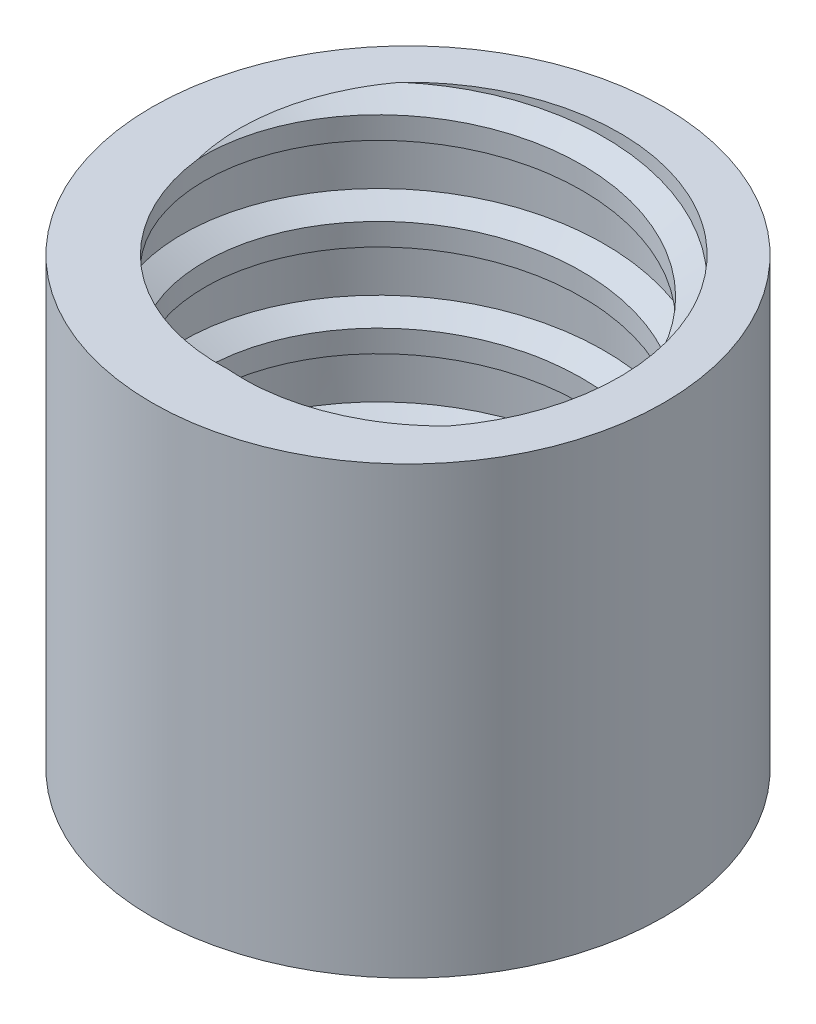
from build123d import *

# Parameters (mm, degrees)
SKETCH1_R           = 11.5
SKETCH1_R_2         = 8.5
BOSS_EXTRUDE1_DEPTH = 20
CUT_SWEEP1_PITCH    = 4.15


with BuildPart() as part:
    # Sketch1 → Boss-Extrude1 (new body)
    with BuildSketch(Plane(origin=(0, 0, 0), x_dir=(1, 0, 0), z_dir=(0, 1, 0))):
        with Locations(Location((0, 0, 0), (0, 0, 270))):
            Circle(SKETCH1_R)
        with Locations(Location((0, 0, 0), (0, 0, 270))):
            Circle(SKETCH1_R_2, mode=Mode.SUBTRACT)
    extrude(amount=BOSS_EXTRUDE1_DEPTH)

    # Cut-Sweep1: arcs per turn and ends read off the stored shape
    # Cut-Sweep1: the profile of Sketch3 profile screwed along a right-hand helix through 9.75 turns, 12 arcs to a turn; built about Z, then put on its axis
    cut_sweep1_z = Axis((0, 0, 0), (0, 0, 1))
    cut_sweep1_corners = [(8.4997, 0, -4.975690688), (8.4997, 0, -1.82064374), (9.5, 0, -2.398167214), (9.5, 0, -4.398167214)]
    with BuildLine(mode=Mode.PRIVATE) as cut_sweep1_profile:
        Line(cut_sweep1_corners[0], cut_sweep1_corners[1])
        Line(cut_sweep1_corners[1], cut_sweep1_corners[2])
        Line(cut_sweep1_corners[2], cut_sweep1_corners[3])
        Line(cut_sweep1_corners[3], cut_sweep1_corners[0])
    cut_sweep1_cap = Face(cut_sweep1_profile.wire())
    cut_sweep1_turn_angles = [0, 15, 30, 45, 60, 75, 90, 105, 120, 135, 150, 165, 180, 195, 210, 225, 240, 255, 270, 285, 300, 315, 330, 345, 360]
    cut_sweep1_turn_weights = [1, 0.9659258262890683, 1, 0.9659258262890683, 1, 0.9659258262890683, 1, 0.9659258262890683, 1, 0.9659258262890683, 1, 0.9659258262890683, 1, 0.9659258262890683, 1, 0.9659258262890683, 1, 0.9659258262890683, 1, 0.9659258262890683, 1, 0.9659258262890683, 1, 0.9659258262890683, 1]
    cut_sweep1_turn_rails = [Edge.make_bspline([Vector(p[0], p[1], 0).rotate(cut_sweep1_z, cut_sweep1_turn_angles[k]) / cut_sweep1_turn_weights[k] + Vector(0, 0, p[2] + CUT_SWEEP1_PITCH * cut_sweep1_turn_angles[k] / 360) for k in range(25)], [0, 0, 0, 1, 1, 2, 2, 3, 3, 4, 4, 5, 5, 6, 6, 7, 7, 8, 8, 9, 9, 10, 10, 11, 11, 12, 12, 12], 2, cut_sweep1_turn_weights) for p in cut_sweep1_corners]
    cut_sweep1_turn_sides = [Face.make_surface_from_curves(cut_sweep1_turn_rails[p[0]], cut_sweep1_turn_rails[p[1]]) for p in [(0, 1), (1, 2), (2, 3), (3, 0)]]
    cut_sweep1_last_angles = [3240, 3255, 3270, 3285, 3300, 3315, 3330, 3345, 3360, 3375, 3390, 3405, 3420, 3435, 3450, 3465, 3480, 3495, 3510]
    cut_sweep1_last_weights = [1, 0.9659258262890683, 1, 0.9659258262890683, 1, 0.9659258262890683, 1, 0.9659258262890683, 1, 0.9659258262890683, 1, 0.9659258262890683, 1, 0.9659258262890683, 1, 0.9659258262890683, 1, 0.9659258262890662, 1]
    cut_sweep1_last_rails = [Edge.make_bspline([Vector(p[0], p[1], 0).rotate(cut_sweep1_z, cut_sweep1_last_angles[k]) / cut_sweep1_last_weights[k] + Vector(0, 0, p[2] + CUT_SWEEP1_PITCH * cut_sweep1_last_angles[k] / 360) for k in range(19)], [0, 0, 0, 1, 1, 2, 2, 3, 3, 4, 4, 5, 5, 6, 6, 7, 7, 8, 8, 9, 9, 9], 2, cut_sweep1_last_weights) for p in cut_sweep1_corners]
    cut_sweep1_last_sides = [Face.make_surface_from_curves(cut_sweep1_last_rails[p[0]], cut_sweep1_last_rails[p[1]]) for p in [(0, 1), (1, 2), (2, 3), (3, 0)]]
    cut_sweep1 = Plane(origin=(0, 0, 0), x_dir=(-1, 0, 0), z_dir=(0, 1, 0)) * Solid(Shell([*[p.moved(Location((0, 0, CUT_SWEEP1_PITCH * i))) for i in range(9) for p in cut_sweep1_turn_sides], *cut_sweep1_last_sides, cut_sweep1_cap, cut_sweep1_cap.rotate(cut_sweep1_z, 3510).moved(Location((0, 0, CUT_SWEEP1_PITCH * 3510 / 360)))]))
    add(cut_sweep1, mode=Mode.SUBTRACT)


solid = part.part
